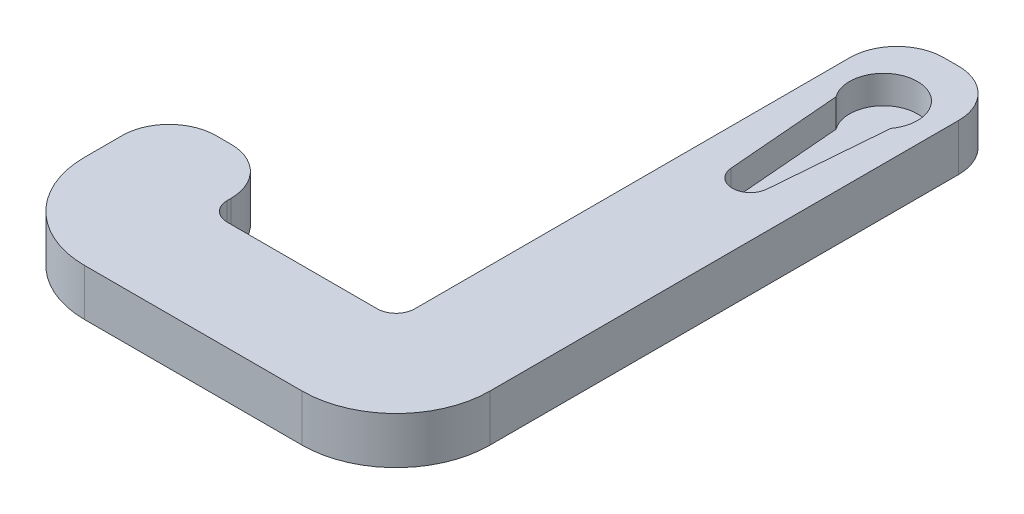
from build123d import *

# Parameters (mm, degrees)
BOSS_EXTRUDE1_DEPTH = 5
CUT_EXTRUDE3_DEPTH  = 3
FILLET1_R           = 5
FILLET2_R           = 10
FILLET3_R           = 5
FILLET4_R           = 2


with BuildPart() as part:
    # Sketch1 → Boss-Extrude1 (new body)
    with BuildSketch(Plane(origin=(0, 0, 0), x_dir=(1, 0, 0), z_dir=(0, 1, 0))):
        Polygon((0, 5.8), (20, 5.8), (20, 59.2), (31.6, 59.2), (31.6, 5.8), (31.6, -5.8), (20, -5.8), (0, -5.8), (-11.6, -5.8), (-11.6, 13.2), (0, 13.2), align=None)
    extrude(amount=BOSS_EXTRUDE1_DEPTH)

    # Sketch2 → Cut-Extrude3 (cut)
    with BuildSketch(Plane(origin=(0, 5, 0), x_dir=(1, 0, 0), z_dir=(0, 1, 0))):
        with BuildLine():
            Line((28.721, 49.841739258), (27.723587356, 37.636800493))
            ThreePointArc((27.723587356, 37.636800493), (25.8, 35.864), (23.876412644, 37.636800493))
            Line((23.876412644, 37.636800493), (22.879, 49.841739258))
            ThreePointArc((22.879, 49.841739258), (25.8, 55.6), (28.721, 49.841739258))
        make_face()
    extrude(amount=-CUT_EXTRUDE3_DEPTH, mode=Mode.SUBTRACT)

    # Fillet1
    fillet1_edges = [part.edges().sort_by_distance(p)[0] for p in [
        (20, 2.5, -59.2),
        (31.6, 2.5, -59.2),
    ]]
    fillet(fillet1_edges, radius=FILLET1_R)

    # Fillet2
    fillet2_edges = [part.edges().sort_by_distance(p)[0] for p in [
        (-11.6, 2.5, 5.8),
        (31.6, 2.5, 5.8),
    ]]
    fillet(fillet2_edges, radius=FILLET2_R)

    # Fillet3
    fillet3_edges = [part.edges().sort_by_distance(p)[0] for p in [
        (0, 2.5, -13.2),
        (-11.6, 2.5, -13.2),
    ]]
    fillet(fillet3_edges, radius=FILLET3_R)

    # Fillet4
    fillet4_edges = [part.edges().sort_by_distance(p)[0] for p in [
        (0, 2.5, -5.8),
        (20, 2.5, -5.8),
    ]]
    fillet(fillet4_edges, radius=FILLET4_R)


solid = part.part
